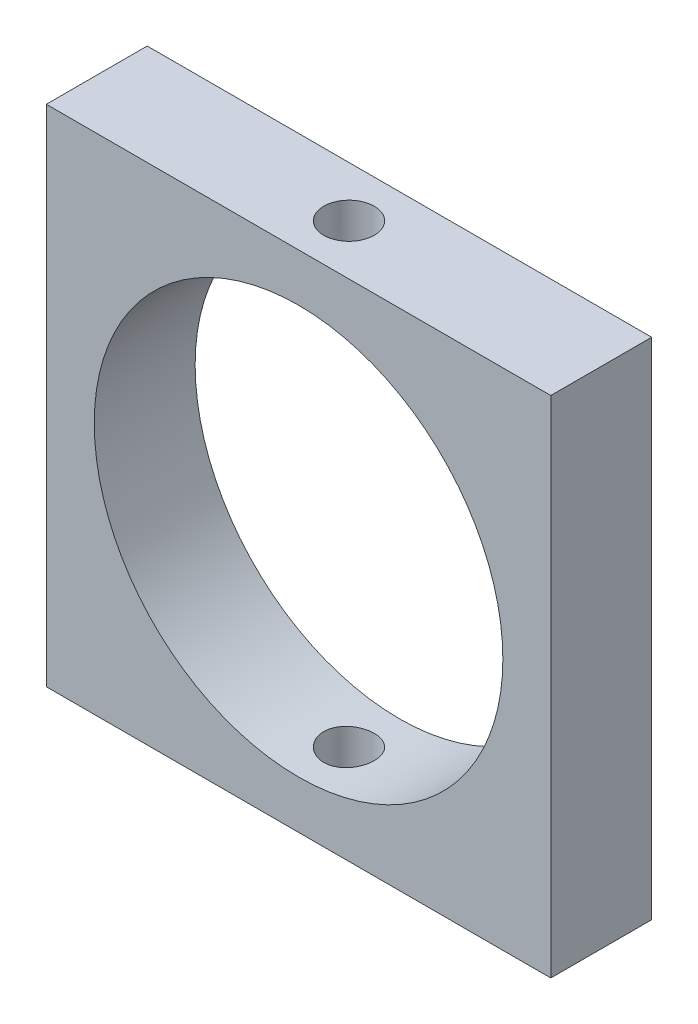
from build123d import *

# Parameters (mm, degrees)
SKETCH1_W           = 20
SKETCH1_H           = 20
SKETCH1_R           = 8.1
BOSS_EXTRUDE1_DEPTH = 4
SKETCH3_R           = 1
CUT_EXTRUDE1_DEPTH  = 20


with BuildPart() as part:
    # Sketch1 → Boss-Extrude1 (new body)
    with BuildSketch(Plane.XY):
        Rectangle(SKETCH1_W, SKETCH1_H)
        Circle(SKETCH1_R, mode=Mode.SUBTRACT)
    extrude(amount=BOSS_EXTRUDE1_DEPTH)

    # Sketch3 → Cut-Extrude1 (cut)
    with BuildSketch(Plane(origin=(0, 10, 0), x_dir=(1, 0, 0), z_dir=(0, 1, 0))):
        with Locations((0, -2)):
            Circle(SKETCH3_R)
    extrude(amount=-CUT_EXTRUDE1_DEPTH, mode=Mode.SUBTRACT)


solid = part.part
